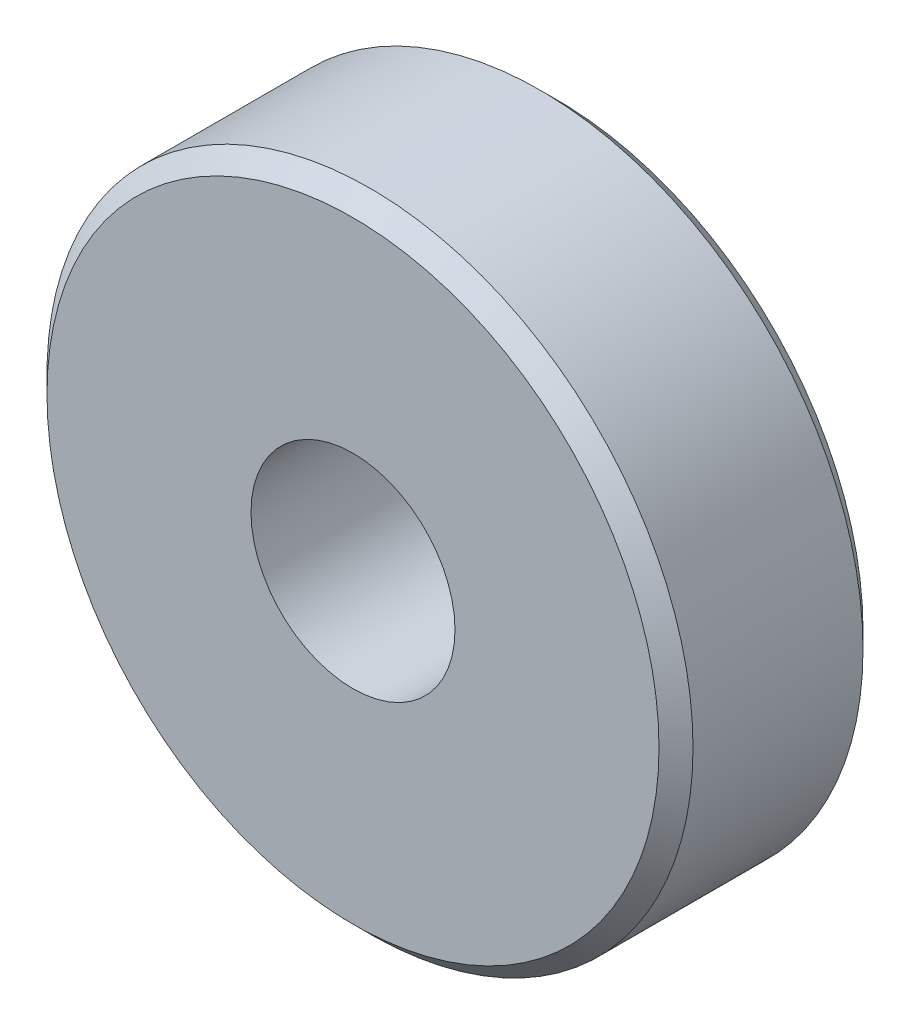
from build123d import *

# Parameters (mm, degrees)
SKETCH1_R           = 9.5
SKETCH1_R_2         = 3
BOSS_EXTRUDE1_DEPTH = 3
CHAMFER1_SIZE       = 0.5


with BuildPart() as part:
    # Sketch1 → Boss-Extrude1 (new, symmetric)
    with BuildSketch(Plane.XY):
        Circle(SKETCH1_R)
        Circle(SKETCH1_R_2, mode=Mode.SUBTRACT)
    extrude(amount=BOSS_EXTRUDE1_DEPTH, both=True)

    # Chamfer1
    chamfer1_edges = [part.edges().sort_by_distance(p)[0] for p in [
        (-9.5, 0, -3),
        (-9.5, 0, 3),
    ]]
    chamfer(chamfer1_edges, length=CHAMFER1_SIZE)


solid = part.part
